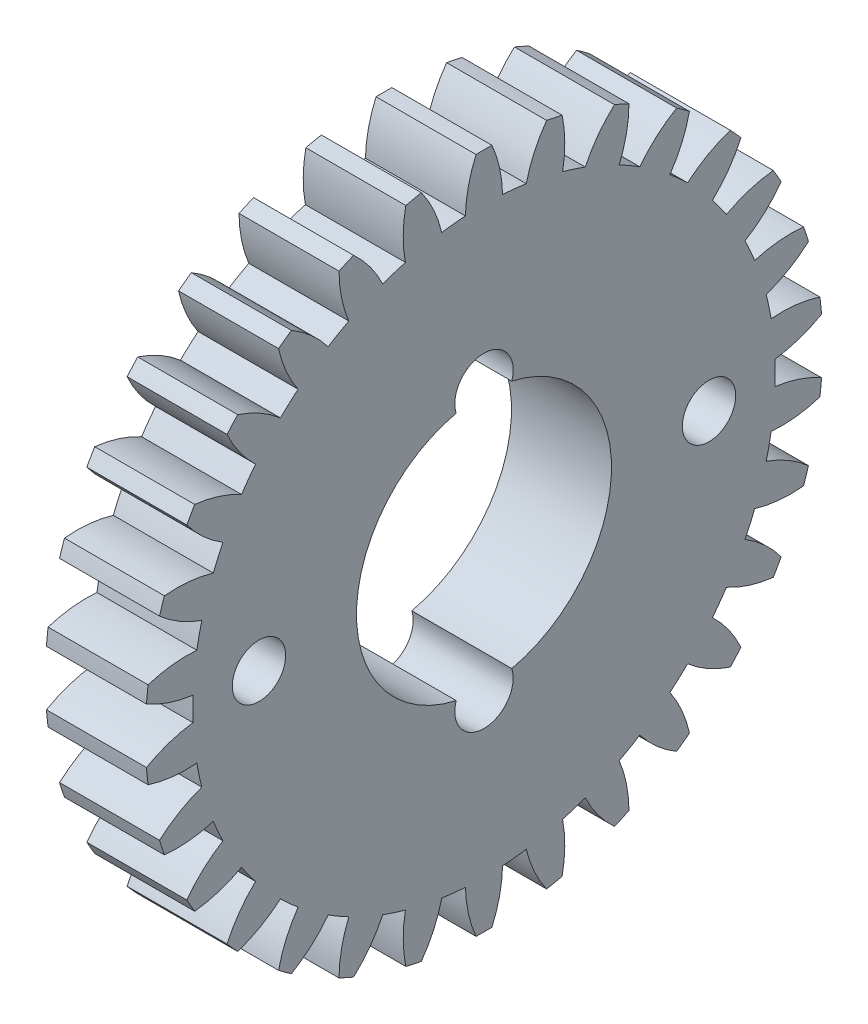
from build123d import *

# Parameters (mm, degrees)
ESBO_O1_R                  = 1.75
ESBO_O1_R_2                = 3
RESSALTO_EXTRUS_O1_DEPTH   = 6
CORTE_EXTRUS_O1_DEPTH      = 30.310152568
CORTE_EXTRUS_O1_DEPTH_BACK = 30.310152568
ESBO_O2_R                  = 1.6
ESBO_O2_R_2                = 7.65


with BuildPart() as part:
    # Esboço1 → Ressalto-extrusão1 (new body)
    with BuildSketch(Plane(origin=(0, 0, 0), x_dir=(0, -1, 0), z_dir=(-1, 0, 0))):
        with BuildLine():
            ThreePointArc((17.439635583, -1.114327495), (18.908103592, -0.935785134), (20.314403461, -0.476877358))
            ThreePointArc((20.314403461, -0.476877358), (20.32, 0), (20.314403461, 0.476877358))
            ThreePointArc((20.314403461, 0.476877358), (18.908103592, 0.935785134), (17.439635583, 1.114327495))
            ThreePointArc((17.439635583, 1.114327495), (17.379469026, 1.826655801), (17.290219417, 2.535927356))
            ThreePointArc((17.290219417, 2.535927356), (18.689476833, 3.015879804), (19.969633384, 3.757145528))
            ThreePointArc((19.969633384, 3.757145528), (19.875959247, 4.224765557), (19.771336628, 4.690058415))
            ThreePointArc((19.771336628, 4.690058415), (18.300355494, 4.846551772), (16.82685599, 4.715880887))
            ThreePointArc((16.82685599, 4.715880887), (16.619902834, 5.40013378), (16.385137694, 6.075350013))
            ThreePointArc((16.385137694, 6.075350013), (17.654030253, 6.835736324), (18.752094502, 7.826963126))
            ThreePointArc((18.752094502, 7.826963126), (18.563243699, 8.264888587), (18.364167511, 8.698261414))
            ThreePointArc((18.364167511, 8.698261414), (16.892794045, 8.545500841), (15.478662046, 8.111327655))
            ThreePointArc((15.478662046, 8.111327655), (15.133967136, 8.7376), (14.76394683, 9.349250721))
            ThreePointArc((14.76394683, 9.349250721), (15.847017839, 10.356838364), (16.714999109, 11.554704877))
            ThreePointArc((16.714999109, 11.554704877), (16.439225326, 11.943796327), (16.154396153, 12.32630865))
            ThreePointArc((16.154396153, 12.32630865), (14.746936436, 11.870970517), (13.453976295, 11.152270482))
            ThreePointArc((13.453976295, 11.152270482), (12.986604454, 11.693191172), (12.497500644, 12.21454431))
            ThreePointArc((12.497500644, 12.21454431), (13.347414702, 13.42529687), (13.947378047, 14.777450579))
            ThreePointArc((13.947378047, 14.777450579), (13.596733921, 15.100702854), (13.238600165, 15.41563705))
            ThreePointArc((13.238600165, 15.41563705), (11.956566942, 14.677621818), (10.841287221, 13.705805574))
            ThreePointArc((10.841287221, 13.705805574), (10.271664841, 14.13773378), (9.68485371, 14.546003701))
            ThreePointArc((9.68485371, 14.546003701), (10.264465495, 15.907005481), (10.570189637, 17.354350781))
            ThreePointArc((10.570189637, 17.354350781), (10.16, 17.597636205), (9.744213824, 17.831228139))
            ThreePointArc((9.744213824, 17.831228139), (8.643638098, 16.842790615), (7.754781873, 15.660331195))
            ThreePointArc((7.754781873, 15.660331195), (7.107804185, 15.964389581), (6.448932196, 16.24173293))
            ThreePointArc((6.448932196, 16.24173293), (6.732909891, 17.693501623), (6.731033219, 19.172782579))
            ThreePointArc((6.731033219, 19.172782579), (6.279225326, 19.325468411), (5.823958582, 19.467508994))
            ThreePointArc((5.823958582, 19.467508994), (4.952940792, 18.271848642), (4.329355346, 16.930425196))
            ThreePointArc((4.329355346, 16.930425196), (3.633298379, 17.093324952), (2.931161399, 17.227620494))
            ThreePointArc((2.931161399, 17.227620494), (2.907093817, 18.70670684), (2.59769835, 20.153271776))
            ThreePointArc((2.59769835, 20.153271776), (2.124018374, 20.208684914), (1.649168402, 20.252966291))
            ThreePointArc((1.649168402, 20.252966291), (1.045776207, 18.902339204), (0.714715216, 17.460578375))
            ThreePointArc((0.714715216, 17.460578375), (0, 17.4752), (-0.714715216, 17.460578375))
            ThreePointArc((-0.714715216, 17.460578375), (-1.045776207, 18.902339204), (-1.649168402, 20.252966291))
            ThreePointArc((-1.649168402, 20.252966291), (-2.124018374, 20.208684914), (-2.59769835, 20.153271776))
            ThreePointArc((-2.59769835, 20.153271776), (-2.907093817, 18.70670684), (-2.931161399, 17.227620494))
            ThreePointArc((-2.931161399, 17.227620494), (-3.633298379, 17.093324952), (-4.329355346, 16.930425196))
            ThreePointArc((-4.329355346, 16.930425196), (-4.952940792, 18.271848642), (-5.823958582, 19.467508994))
            ThreePointArc((-5.823958582, 19.467508994), (-6.279225326, 19.325468411), (-6.731033219, 19.172782579))
            ThreePointArc((-6.731033219, 19.172782579), (-6.732909891, 17.693501623), (-6.448932196, 16.24173293))
            ThreePointArc((-6.448932196, 16.24173293), (-7.107804185, 15.964389581), (-7.754781873, 15.660331195))
            ThreePointArc((-7.754781873, 15.660331195), (-8.643638098, 16.842790615), (-9.744213824, 17.831228139))
            ThreePointArc((-9.744213824, 17.831228139), (-10.16, 17.597636205), (-10.570189637, 17.354350781))
            ThreePointArc((-10.570189637, 17.354350781), (-10.264465495, 15.907005481), (-9.68485371, 14.546003701))
            ThreePointArc((-9.68485371, 14.546003701), (-10.271664841, 14.13773378), (-10.841287221, 13.705805574))
            ThreePointArc((-10.841287221, 13.705805574), (-11.956566942, 14.677621818), (-13.238600165, 15.41563705))
            ThreePointArc((-13.238600165, 15.41563705), (-13.596733921, 15.100702854), (-13.947378047, 14.777450579))
            ThreePointArc((-13.947378047, 14.777450579), (-13.347414702, 13.42529687), (-12.497500644, 12.21454431))
            ThreePointArc((-12.497500644, 12.21454431), (-12.986604454, 11.693191172), (-13.453976295, 11.152270482))
            ThreePointArc((-13.453976295, 11.152270482), (-14.746936436, 11.870970517), (-16.154396153, 12.32630865))
            ThreePointArc((-16.154396153, 12.32630865), (-16.439225326, 11.943796327), (-16.714999109, 11.554704877))
            ThreePointArc((-16.714999109, 11.554704877), (-15.847017839, 10.356838364), (-14.76394683, 9.349250721))
            ThreePointArc((-14.76394683, 9.349250721), (-15.133967136, 8.7376), (-15.478662046, 8.111327655))
            ThreePointArc((-15.478662046, 8.111327655), (-16.892794045, 8.545500841), (-18.364167511, 8.698261414))
            ThreePointArc((-18.364167511, 8.698261414), (-18.563243699, 8.264888587), (-18.752094502, 7.826963126))
            ThreePointArc((-18.752094502, 7.826963126), (-17.654030253, 6.835736324), (-16.385137694, 6.075350013))
            ThreePointArc((-16.385137694, 6.075350013), (-16.619902834, 5.40013378), (-16.82685599, 4.715880887))
            ThreePointArc((-16.82685599, 4.715880887), (-18.300355494, 4.846551772), (-19.771336628, 4.690058415))
            ThreePointArc((-19.771336628, 4.690058415), (-19.875959247, 4.224765557), (-19.969633384, 3.757145528))
            ThreePointArc((-19.969633384, 3.757145528), (-18.689476833, 3.015879804), (-17.290219417, 2.535927356))
            ThreePointArc((-17.290219417, 2.535927356), (-17.379469026, 1.826655801), (-17.439635583, 1.114327495))
            ThreePointArc((-17.439635583, 1.114327495), (-18.908103592, 0.935785134), (-20.314403461, 0.476877358))
            ThreePointArc((-20.314403461, 0.476877358), (-20.32, 0), (-20.314403461, -0.476877358))
            ThreePointArc((-20.314403461, -0.476877358), (-18.908103592, -0.935785134), (-17.439635583, -1.114327495))
            ThreePointArc((-17.439635583, -1.114327495), (-17.379469026, -1.826655801), (-17.290219417, -2.535927356))
            ThreePointArc((-17.290219417, -2.535927356), (-18.689476833, -3.015879804), (-19.969633384, -3.757145528))
            ThreePointArc((-19.969633384, -3.757145528), (-19.875959247, -4.224765557), (-19.771336628, -4.690058415))
            ThreePointArc((-19.771336628, -4.690058415), (-18.300355494, -4.846551772), (-16.82685599, -4.715880887))
            ThreePointArc((-16.82685599, -4.715880887), (-16.619902834, -5.40013378), (-16.385137694, -6.075350013))
            ThreePointArc((-16.385137694, -6.075350013), (-17.654030253, -6.835736324), (-18.752094502, -7.826963126))
            ThreePointArc((-18.752094502, -7.826963126), (-18.563243699, -8.264888587), (-18.364167511, -8.698261414))
            ThreePointArc((-18.364167511, -8.698261414), (-16.892794045, -8.545500841), (-15.478662046, -8.111327655))
            ThreePointArc((-15.478662046, -8.111327655), (-15.133967136, -8.7376), (-14.76394683, -9.349250721))
            ThreePointArc((-14.76394683, -9.349250721), (-15.847017839, -10.356838364), (-16.714999109, -11.554704877))
            ThreePointArc((-16.714999109, -11.554704877), (-16.439225326, -11.943796327), (-16.154396153, -12.32630865))
            ThreePointArc((-16.154396153, -12.32630865), (-14.746936436, -11.870970517), (-13.453976295, -11.152270482))
            ThreePointArc((-13.453976295, -11.152270482), (-12.986604454, -11.693191172), (-12.497500644, -12.21454431))
            ThreePointArc((-12.497500644, -12.21454431), (-13.347414702, -13.42529687), (-13.947378047, -14.777450579))
            ThreePointArc((-13.947378047, -14.777450579), (-13.596733921, -15.100702854), (-13.238600165, -15.41563705))
            ThreePointArc((-13.238600165, -15.41563705), (-11.956566942, -14.677621818), (-10.841287221, -13.705805574))
            ThreePointArc((-10.841287221, -13.705805574), (-10.271664841, -14.13773378), (-9.68485371, -14.546003701))
            ThreePointArc((-9.68485371, -14.546003701), (-10.264465495, -15.907005481), (-10.570189637, -17.354350781))
            ThreePointArc((-10.570189637, -17.354350781), (-10.16, -17.597636205), (-9.744213824, -17.831228139))
            ThreePointArc((-9.744213824, -17.831228139), (-8.643638098, -16.842790615), (-7.754781873, -15.660331195))
            ThreePointArc((-7.754781873, -15.660331195), (-7.107804185, -15.964389581), (-6.448932196, -16.24173293))
            ThreePointArc((-6.448932196, -16.24173293), (-6.732909891, -17.693501623), (-6.731033219, -19.172782579))
            ThreePointArc((-6.731033219, -19.172782579), (-6.279225326, -19.325468411), (-5.823958582, -19.467508994))
            ThreePointArc((-5.823958582, -19.467508994), (-4.952940792, -18.271848642), (-4.329355346, -16.930425196))
            ThreePointArc((-4.329355346, -16.930425196), (-3.633298379, -17.093324952), (-2.931161399, -17.227620494))
            ThreePointArc((-2.931161399, -17.227620494), (-2.907093817, -18.70670684), (-2.59769835, -20.153271776))
            ThreePointArc((-2.59769835, -20.153271776), (-2.124018374, -20.208684914), (-1.649168402, -20.252966291))
            ThreePointArc((-1.649168402, -20.252966291), (-1.045776207, -18.902339204), (-0.714715216, -17.460578375))
            ThreePointArc((-0.714715216, -17.460578375), (0, -17.4752), (0.714715216, -17.460578375))
            ThreePointArc((0.714715216, -17.460578375), (1.045776207, -18.902339204), (1.649168402, -20.252966291))
            ThreePointArc((1.649168402, -20.252966291), (2.124018374, -20.208684914), (2.59769835, -20.153271776))
            ThreePointArc((2.59769835, -20.153271776), (2.907093817, -18.70670684), (2.931161399, -17.227620494))
            ThreePointArc((2.931161399, -17.227620494), (3.633298379, -17.093324952), (4.329355346, -16.930425196))
            ThreePointArc((4.329355346, -16.930425196), (4.952940792, -18.271848642), (5.823958582, -19.467508994))
            ThreePointArc((5.823958582, -19.467508994), (6.279225326, -19.325468411), (6.731033219, -19.172782579))
            ThreePointArc((6.731033219, -19.172782579), (6.732909891, -17.693501623), (6.448932196, -16.24173293))
            ThreePointArc((6.448932196, -16.24173293), (7.107804185, -15.964389581), (7.754781873, -15.660331195))
            ThreePointArc((7.754781873, -15.660331195), (8.643638098, -16.842790615), (9.744213824, -17.831228139))
            ThreePointArc((9.744213824, -17.831228139), (10.16, -17.597636205), (10.570189637, -17.354350781))
            ThreePointArc((10.570189637, -17.354350781), (10.264465495, -15.907005481), (9.68485371, -14.546003701))
            ThreePointArc((9.68485371, -14.546003701), (10.271664841, -14.13773378), (10.841287221, -13.705805574))
            ThreePointArc((10.841287221, -13.705805574), (11.956566942, -14.677621818), (13.238600165, -15.41563705))
            ThreePointArc((13.238600165, -15.41563705), (13.596733921, -15.100702854), (13.947378047, -14.777450579))
            ThreePointArc((13.947378047, -14.777450579), (13.347414702, -13.42529687), (12.497500644, -12.21454431))
            ThreePointArc((12.497500644, -12.21454431), (12.986604454, -11.693191172), (13.453976295, -11.152270482))
            ThreePointArc((13.453976295, -11.152270482), (14.746936436, -11.870970517), (16.154396153, -12.32630865))
            ThreePointArc((16.154396153, -12.32630865), (16.439225326, -11.943796327), (16.714999109, -11.554704877))
            ThreePointArc((16.714999109, -11.554704877), (15.847017839, -10.356838364), (14.76394683, -9.349250721))
            ThreePointArc((14.76394683, -9.349250721), (15.133967136, -8.7376), (15.478662046, -8.111327655))
            ThreePointArc((15.478662046, -8.111327655), (16.892794045, -8.545500841), (18.364167511, -8.698261414))
            ThreePointArc((18.364167511, -8.698261414), (18.563243699, -8.264888587), (18.752094502, -7.826963126))
            ThreePointArc((18.752094502, -7.826963126), (17.654030253, -6.835736324), (16.385137694, -6.075350013))
            ThreePointArc((16.385137694, -6.075350013), (16.619902834, -5.40013378), (16.82685599, -4.715880887))
            ThreePointArc((16.82685599, -4.715880887), (18.300355494, -4.846551772), (19.771336628, -4.690058415))
            ThreePointArc((19.771336628, -4.690058415), (19.875959247, -4.224765557), (19.969633384, -3.757145528))
            ThreePointArc((19.969633384, -3.757145528), (18.689476833, -3.015879804), (17.290219417, -2.535927356))
            ThreePointArc((17.290219417, -2.535927356), (17.379469026, -1.826655801), (17.439635583, -1.114327495))
        make_face()
        with Locations((8, 0)):
            Circle(ESBO_O1_R, mode=Mode.SUBTRACT)
        Circle(ESBO_O1_R_2, mode=Mode.SUBTRACT)
        with Locations((-8, 0)):
            Circle(ESBO_O1_R, mode=Mode.SUBTRACT)
    extrude(amount=-RESSALTO_EXTRUS_O1_DEPTH)

    # Esboço2 → Corte-extrusão1 (cut, two sides: drawn at the far end of the back side and taken through both)
    with BuildSketch(Plane(origin=(6, 0, 0), x_dir=(0, 0, -1), z_dir=(1, 0, 0)).offset(-CORTE_EXTRUS_O1_DEPTH_BACK)):
        with Locations((-13.5, 0)):
            Circle(ESBO_O2_R)
        with Locations((13.5, 0)):
            Circle(ESBO_O2_R)
        Circle(ESBO_O2_R_2)
    extrude(amount=CORTE_EXTRUS_O1_DEPTH + CORTE_EXTRUS_O1_DEPTH_BACK, mode=Mode.SUBTRACT)


solid = part.part
